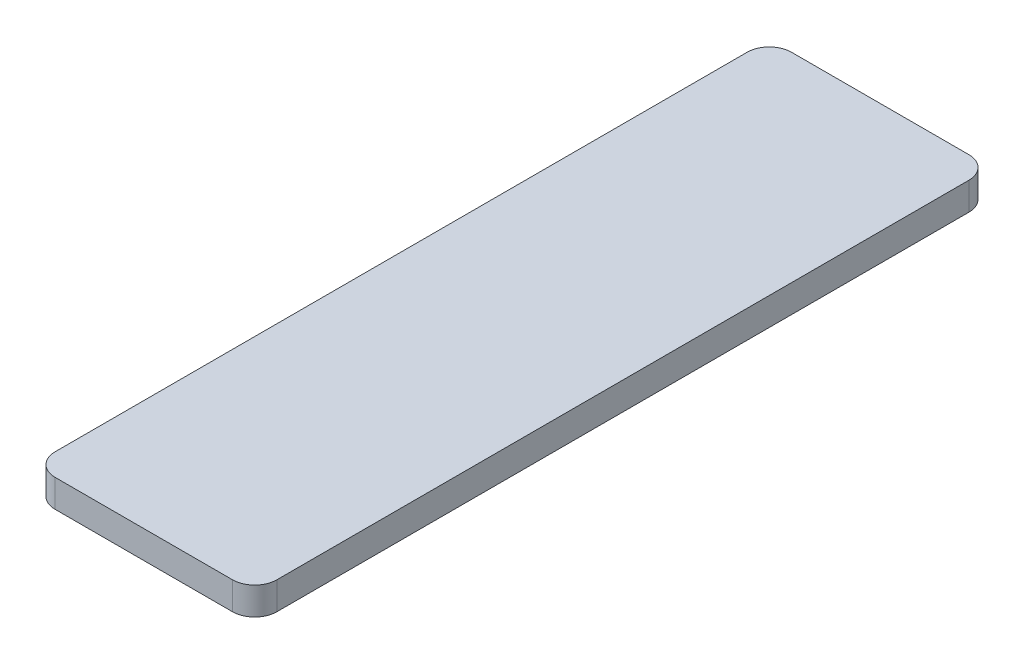
from build123d import *

# Parameters (mm, degrees)
SKETCH1_W           = 25.4
SKETCH1_H           = 84.35
BOSS_EXTRUDE1_DEPTH = 3.175
FILLET1_R           = 2.54


with BuildPart() as part:
    # Sketch1 → Boss-Extrude1 (new body)
    with BuildSketch(Plane(origin=(0, 0, 0), x_dir=(1, 0, 0), z_dir=(0, 1, 0))):
        with Locations((12.7, 42.175)):
            Rectangle(SKETCH1_W, SKETCH1_H)
    extrude(amount=BOSS_EXTRUDE1_DEPTH)

    # Fillet1
    fillet1_edges = [part.edges().sort_by_distance(p)[0] for p in [
        (25.4, 1.5875, 0),
        (0, 1.5875, 0),
        (25.4, 1.5875, -84.35),
        (0, 1.5875, -84.35),
    ]]
    fillet(fillet1_edges, radius=FILLET1_R)


solid = part.part
